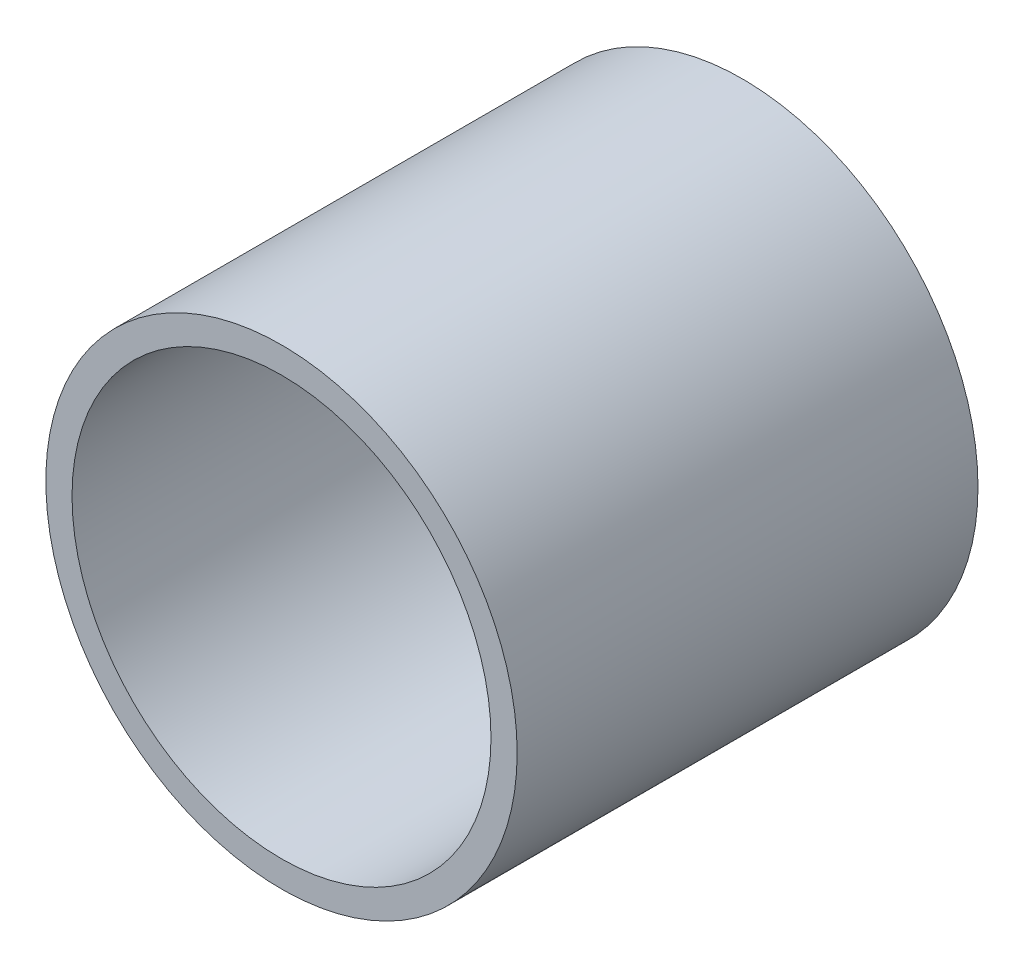
from build123d import *

# Parameters (mm, degrees)
SKETCH1_R      = 7.14375
EXTRUDE1_DEPTH = 13.97
EXTRUDE2_REACH = 19.24
SKETCH2_R      = 6.35


with BuildPart() as part:
    # Sketch1 → Extrude1 (new body)
    with BuildSketch(Plane.XY):
        Circle(SKETCH1_R)
    extrude(amount=EXTRUDE1_DEPTH)

    # Sketch2 → Extrude2 (cut, up to next)
    with BuildSketch(Plane.XY.offset(13.97), mode=Mode.PRIVATE) as extrude2_sk1:
        Circle(SKETCH2_R)
    extrude2_tool1 = extrude(extrude2_sk1.sketch, amount=-EXTRUDE2_REACH, mode=Mode.PRIVATE) & part.part
    add(extrude2_tool1.solids().sort_by_distance((0, 0, 13.97))[0], mode=Mode.SUBTRACT)


solid = part.part
